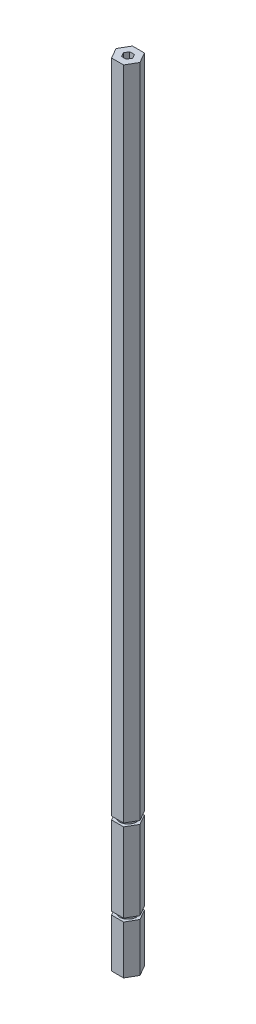
from build123d import *

# Parameters (mm, degrees)
BOSS_EXTRUDE1_DEPTH = 482.6
SKETCH3_W           = 2.54
SKETCH3_H           = 2.032


with BuildPart() as part:
    # Sketch1 → Boss-Extrude1 (new body)
    with BuildSketch(Plane(origin=(0, 0, 0), x_dir=(1, 0, 0), z_dir=(0, 1, 0))):
        Polygon((7.332348419, 0), (3.666174209, 6.35), (-3.666174209, 6.35), (-7.332348419, 0), (-3.666174209, -6.35), (3.666174209, -6.35), align=None)
        Polygon((1.443375673, 2.5), (-1.443375673, 2.5), (-2.886751346, 0), (-1.443375673, -2.5), (1.443375673, -2.5), (2.886751346, 0), align=None, mode=Mode.SUBTRACT)
    extrude(amount=BOSS_EXTRUDE1_DEPTH)

    # Sketch3 → Cut-Revolve2 (revolve, cut)
    with BuildSketch(Plane(origin=(0, 0, 0), x_dir=(0, 0, -1), z_dir=(1, 0, 0))):
        with Locations((6.2865, 80.899)):
            Rectangle(SKETCH3_W, SKETCH3_H)
        with Locations((6.2865, 30.607)):
            Rectangle(SKETCH3_W, SKETCH3_H)
    revolve(axis=Axis((0, 482.6, 0), (0, -1, 0)), mode=Mode.SUBTRACT)


solid = part.part
